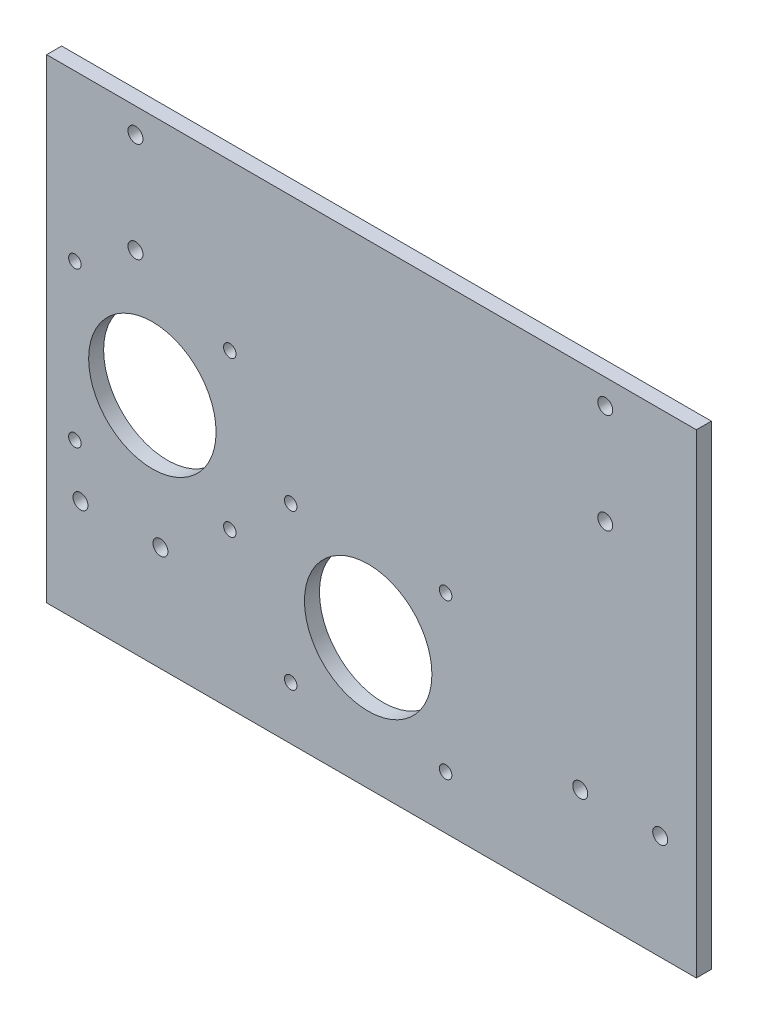
from build123d import *

# Parameters (mm, degrees)
SKETCH_1_W          = 130
SKETCH_1_H          = 95
EXTRUDE_1_DEPTH     = 3
SKETCH_3_R          = 1.5
CUT_EXTRUDE_2_DEPTH = 10
SKETCH_4_R          = 1.5
CUT_EXTRUDE_3_DEPTH = 10
SKETCH_6_R          = 12.75
CUT_EXTRUDE_4_DEPTH = 10
SKETCH_7_R          = 1.25
CUT_EXTRUDE_5_DEPTH = 10


with BuildPart() as part:
    # 草图1 → 凸台-拉伸1 (new body)
    with BuildSketch(Plane.XY):
        Rectangle(SKETCH_1_W, SKETCH_1_H)
    extrude(amount=EXTRUDE_1_DEPTH)

    # 草图3 → 切除-拉伸2 (cut)
    with BuildSketch(Plane(origin=(0, 0, 0), x_dir=(-1, 0, 0), z_dir=(0, 0, -1))):
        with Locations((-57.767112616, -26.5)):
            Circle(SKETCH_3_R)
        with Locations((-41.767112616, -26.5)):
            Circle(SKETCH_3_R)
        with Locations((42.232887384, -26.5)):
            Circle(SKETCH_3_R)
        with Locations((58.232887384, -26.5)):
            Circle(SKETCH_3_R)
    extrude(amount=-CUT_EXTRUDE_2_DEPTH, mode=Mode.SUBTRACT)

    # 草图4 → 切除-拉伸3 (cut)
    with BuildSketch(Plane(origin=(0, 0, 0), x_dir=(-1, 0, 0), z_dir=(0, 0, -1))):
        with Locations((-46.767112616, 42.5)):
            Circle(SKETCH_4_R)
        with Locations((-46.767112616, 22.5)):
            Circle(SKETCH_4_R)
        with Locations((47.232887384, 42.5)):
            Circle(SKETCH_4_R)
        with Locations((47.232887384, 22.5)):
            Circle(SKETCH_4_R)
    extrude(amount=-CUT_EXTRUDE_3_DEPTH, mode=Mode.SUBTRACT)

    # 草图6 → 切除-拉伸4 (cut)
    with BuildSketch(Plane(origin=(0, 0, 0), x_dir=(-1, 0, 0), z_dir=(0, 0, -1))):
        with Locations((0.667515318, -21.35)):
            Circle(SKETCH_6_R)
        with Locations((43.85, -0.957917179)):
            Circle(SKETCH_6_R)
    extrude(amount=-CUT_EXTRUDE_4_DEPTH, mode=Mode.SUBTRACT)

    # 草图7 → 切除-拉伸5 (cut)
    with BuildSketch(Plane.XY.offset(3)):
        with Locations((-59.35, 14.542082821)):
            Circle(SKETCH_7_R)
        with Locations((-28.35, 14.542082821)):
            Circle(SKETCH_7_R)
        with Locations((-59.35, -16.457917179)):
            Circle(SKETCH_7_R)
        with Locations((-28.35, -16.457917179)):
            Circle(SKETCH_7_R)
        with Locations((-16.167515318, -5.85)):
            Circle(SKETCH_7_R)
        with Locations((14.832484682, -5.85)):
            Circle(SKETCH_7_R)
        with Locations((14.832484682, -36.85)):
            Circle(SKETCH_7_R)
        with Locations((-16.167515318, -36.85)):
            Circle(SKETCH_7_R)
    extrude(amount=-CUT_EXTRUDE_5_DEPTH, mode=Mode.SUBTRACT)


solid = part.part
